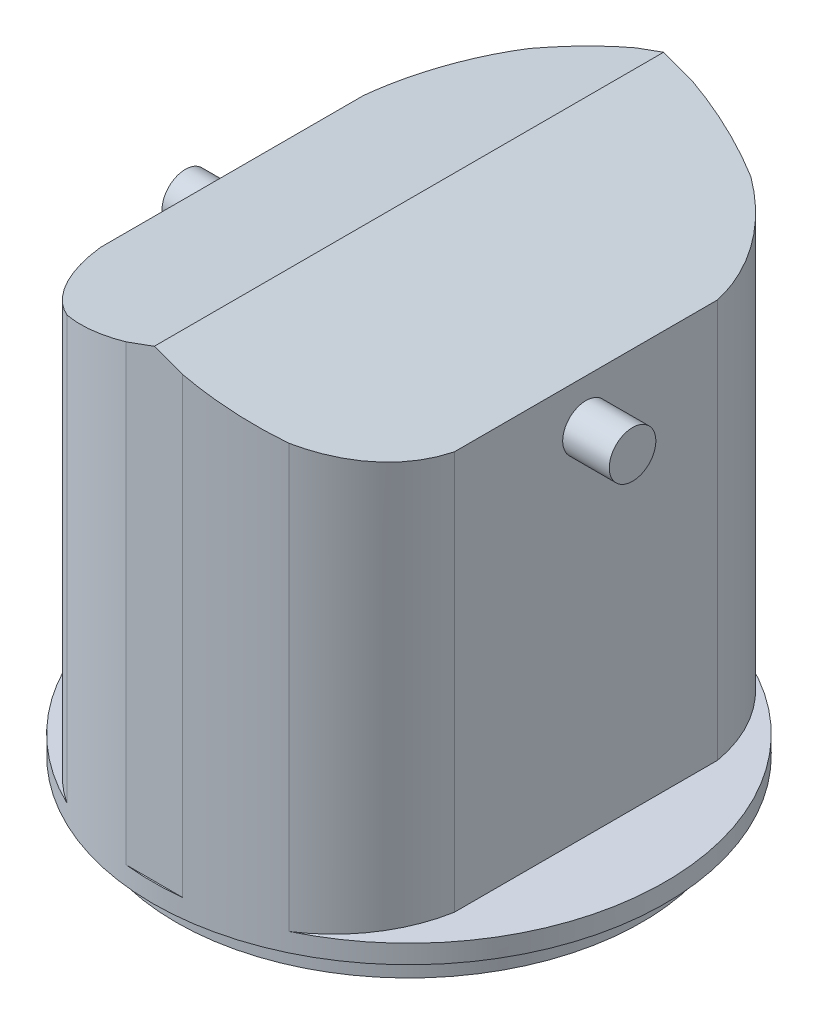
from build123d import *

# Parameters (mm, degrees)
SKETCH1_R           = 27.5
BOSS_EXTRUDE1_DEPTH = 2
SKETCH2_R           = 25
SKETCH2_R_2         = 23
BOSS_EXTRUDE2_DEPTH = 3
BOSS_EXTRUDE3_DEPTH = 50.8
CHAMFER1_SIZE       = 21.979819356
CHAMFER1_SIZE_2     = 8
SKETCH4_R           = 2.5
BOSS_EXTRUDE4_DEPTH = 5


with BuildPart() as part:
    # Sketch1 → Boss-Extrude1 (new body)
    with BuildSketch(Plane(origin=(0, 0, 0), x_dir=(1, 0, 0), z_dir=(0, 1, 0))):
        with Locations(Location((0, 0, 0), (0, 0, 270))):
            Circle(SKETCH1_R)
    extrude(amount=BOSS_EXTRUDE1_DEPTH)

    # Sketch2 → Boss-Extrude2 (add)
    with BuildSketch(Plane.XZ):
        with Locations(Location((0, 0, 0), (0, 0, 90))):
            Circle(SKETCH2_R)
        with Locations(Location((0, 0, 0), (0, 0, 270))):
            Circle(SKETCH2_R_2, mode=Mode.SUBTRACT)
    extrude(amount=BOSS_EXTRUDE2_DEPTH)

    # Sketch3 → Boss-Extrude3 (add)
    with BuildSketch(Plane(origin=(0, 2, 0), x_dir=(1, 0, 0), z_dir=(0, 1, 0))):
        with BuildLine():
            ThreePointArc((-11.903598775, 24.790206457), (-16.564617944, 20.201602313), (-19, 14.131239727))
            Line((-19, 14.131239727), (-19, -14.131239727))
            ThreePointArc((-19, -14.131239727), (-16.564617944, -20.201602313), (-11.903598775, -24.790206457))
            ThreePointArc((-11.903598775, -24.790206457), (-7.564953068, -26.43901445), (-3.010813341, -27.334684981))
            Line((-3.010813341, -27.334684981), (3.010813341, -27.334684981))
            ThreePointArc((3.010813341, -27.334684981), (7.564953068, -26.43901445), (11.903598775, -24.790206457))
            ThreePointArc((11.903598775, -24.790206457), (16.564617944, -20.201602313), (19, -14.131239727))
            Line((19, -14.131239727), (19, 14.131239727))
            ThreePointArc((19, 14.131239727), (16.564617944, 20.201602313), (11.903598775, 24.790206457))
            ThreePointArc((11.903598775, 24.790206457), (7.564953068, 26.43901445), (3.010813341, 27.334684981))
            Line((3.010813341, 27.334684981), (-3.010813341, 27.334684981))
            ThreePointArc((-3.010813341, 27.334684981), (-7.564953068, 26.43901445), (-11.903598775, 24.790206457))
        make_face()
    extrude(amount=BOSS_EXTRUDE3_DEPTH)

    # Chamfer1
    # the kernel refuses this chamfer: 21.979819356, 8 mm, written as the material it takes off along each edge
    with BuildSketch(Plane(origin=(19, 52.8, 71.151171322), x_dir=(-0.9999130865277316, 0.013184058198645697, 0), z_dir=(0, 0, -1)), Plane(origin=(-19, 52.8, -71.151171322), x_dir=(0.9999130865277316, 0.013184058198645697, 0), z_dir=(0, 0, 1))) as chamfer1_piece_1:
        Polygon((CHAMFER1_SIZE * 0.999913086511, -CHAMFER1_SIZE * 0.0131840581984), (-CHAMFER1_SIZE_2 * 0.0131840581986, -CHAMFER1_SIZE_2 * 0.999913086528), (0, 0), align=None)
    extrude(amount=142.302342643, mode=Mode.SUBTRACT)

    # Sketch4 → Boss-Extrude4 (add)
    with BuildSketch(Plane.ZY.offset(19)):
        with Locations(Location((0, 40, 0), (0, 0, 180))):
            Circle(SKETCH4_R)
    boss_extrude4 = extrude(amount=BOSS_EXTRUDE4_DEPTH)

    # Mirror1: Boss-Extrude4 across plane
    add(boss_extrude4.mirror(Plane(origin=(0, 0, 0), x_dir=(0, 0, 1), z_dir=(1, 0, 0))))


solid = part.part
